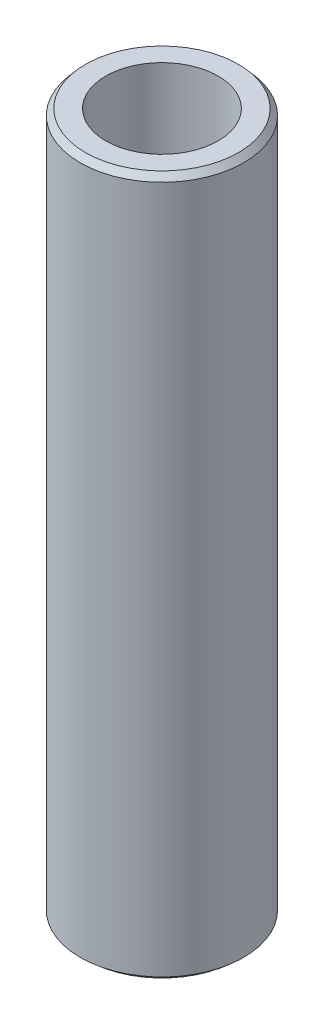
from build123d import *
from OCP.BRepFilletAPI import BRepFilletAPI_MakeChamfer

# Parameters (mm, degrees)
SKETCH1_R           = 60
BOSS_EXTRUDE1_DEPTH = 513.289780487
SKETCH2_R           = 41.225482105
CUT_EXTRUDE1_DEPTH  = 521.256089587
CHAMFER1_SIZE       = 4.508975974
CHAMFER1_SIZE2      = 3.870833355


with BuildPart() as part:
    # Sketch1 → Boss-Extrude1 (new body)
    with BuildSketch(Plane(origin=(0, 0, 0), x_dir=(1, 0, 0), z_dir=(0, 1, 0))):
        Circle(SKETCH1_R)
    extrude(amount=BOSS_EXTRUDE1_DEPTH)

    # Sketch2 → Cut-Extrude1 (cut, through all)
    with BuildSketch(Plane(origin=(0, 0, 0), x_dir=(1, 0, 0), z_dir=(0, 1, 0))):
        Circle(SKETCH2_R)
    extrude(amount=CUT_EXTRUDE1_DEPTH, mode=Mode.SUBTRACT)

    # Chamfer1: one chamfer whose edges measure the first distance from different faces: ONE call of the kernel's chamfer builder (chamfer() names one face for all edges)
    chamfer1_edges_1 = [part.edges().sort_by_distance(p)[0] for p in [
        (-60, 513.289780487, 0),
    ]]
    chamfer1_side_1 = [part.faces().sort_by_distance(p)[0] for p in [
        (-60, 256.644890243, 0),
    ]]
    chamfer1_edges_2 = [part.edges().sort_by_distance(p)[0] for p in [
        (-60, 0, 0),
    ]]
    chamfer1_side_2 = [part.faces().sort_by_distance(p)[0] for p in [
        (-58.302943725, 0, 0),
    ]]
    chamfer1 = BRepFilletAPI_MakeChamfer(part.part.solid().wrapped)
    for e in chamfer1_edges_1:
        chamfer1.Add(CHAMFER1_SIZE, CHAMFER1_SIZE2, e.wrapped, chamfer1_side_1[0].wrapped)  # the first distance lies on this face
    for e in chamfer1_edges_2:
        chamfer1.Add(CHAMFER1_SIZE, CHAMFER1_SIZE2, e.wrapped, chamfer1_side_2[0].wrapped)  # the first distance lies on this face
    add(Compound.cast(chamfer1.Shape()), mode=Mode.REPLACE)


solid = part.part
